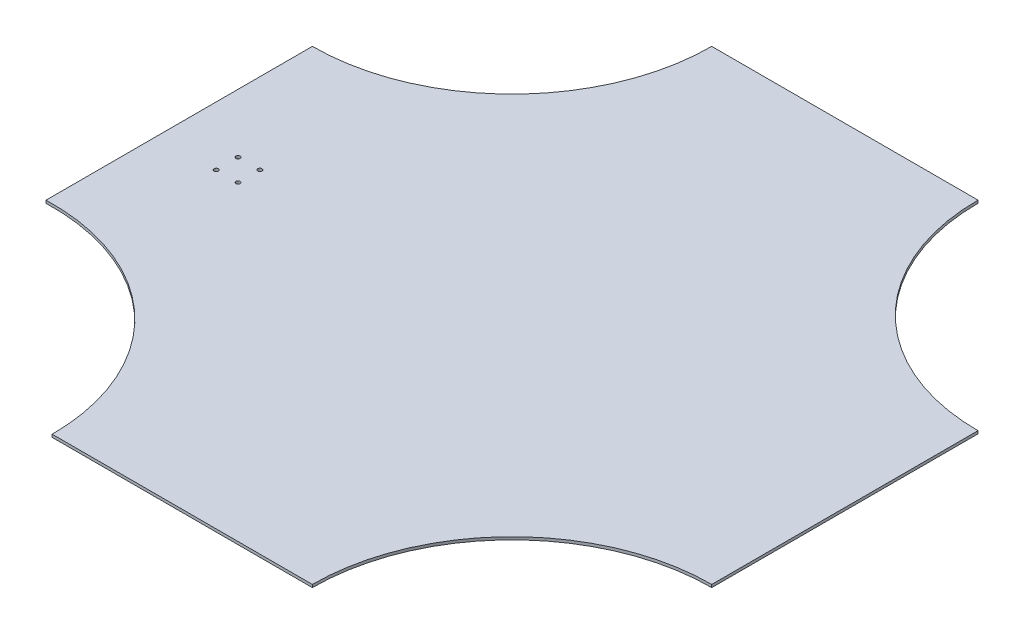
from build123d import *

# Parameters (mm, degrees)
BOSS_EXTRUDE1_DEPTH     = 3.175
CUT_EXTRUDE1_DEPTH      = 539.824721616
CUT_EXTRUDE1_DEPTH_BACK = 539.824721616
SKETCH2_R               = 2.413


with BuildPart() as part:
    # Sketch1 → Boss-Extrude1 (new body)
    with BuildSketch(Plane(origin=(0, 0, 0), x_dir=(1, 0, 0), z_dir=(0, 1, 0))):
        with BuildLine():
            Line((-145.440228772, -381), (152.4, -381))
            ThreePointArc((152.4, -381), (219.355389821, -219.355389821), (381, -152.4))
            Line((381, -152.4), (381, 152.4))
            ThreePointArc((381, 152.4), (219.355389821, 219.355389821), (152.4, 381))
            Line((152.4, 381), (-152.4, 381))
            ThreePointArc((-152.4, 381), (-219.355389821, 219.355389821), (-381, 152.4))
            Line((-381, 152.4), (-381, -152.505970353))
            ThreePointArc((-381, -152.505970353), (-214.875288698, -216.913188064), (-145.440228772, -381))
        make_face()
    extrude(amount=BOSS_EXTRUDE1_DEPTH)

    # Sketch2 → Cut-Extrude1 (cut, two sides: drawn at the far end of the back side and taken through both)
    with BuildSketch(Plane(origin=(0, 3.175, 0), x_dir=(1, 0, 0), z_dir=(0, 1, 0)).offset(-CUT_EXTRUDE1_DEPTH_BACK)):
        with Locations((-313.595907521, 0)):
            Circle(SKETCH2_R)
        with Locations((-288.595615667, 0)):
            Circle(SKETCH2_R)
        with Locations((-288.595615667, -25.116003448)):
            Circle(SKETCH2_R)
        with Locations((-313.595907521, -25.116003448)):
            Circle(SKETCH2_R)
    extrude(amount=CUT_EXTRUDE1_DEPTH + CUT_EXTRUDE1_DEPTH_BACK, mode=Mode.SUBTRACT)


solid = part.part
